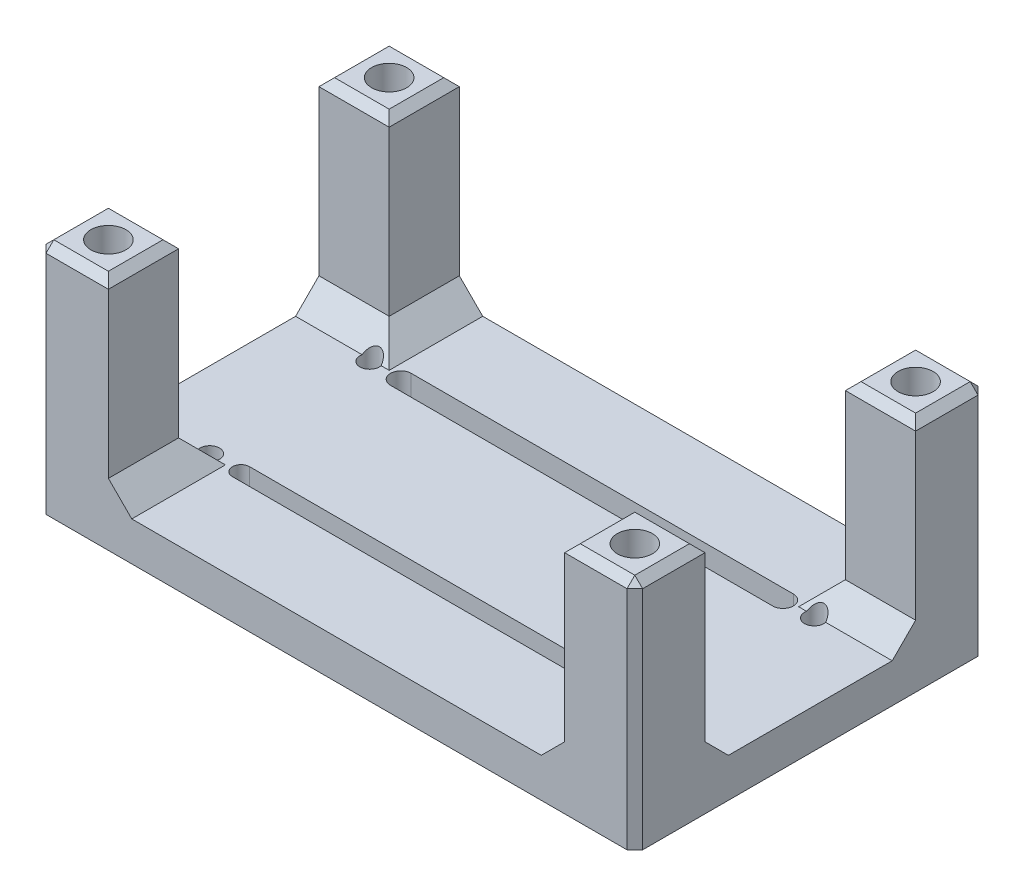
from build123d import *

# Parameters (mm, degrees)
SKETCH1_W           = 76.5
SKETCH1_H           = 45
SKETCH1_R           = 1.25
BOSS_EXTRUDE1_DEPTH = 5
SKETCH2_W           = 9
SKETCH2_H           = 9
SKETCH2_R           = 2.25
BOSS_EXTRUDE2_DEPTH = 25
CHAMFER1_SIZE       = 1
CHAMFER2_SIZE       = 3


with BuildPart() as part:
    # Sketch1 → Boss-Extrude1 (new body)
    with BuildSketch(Plane(origin=(0, 0, 0), x_dir=(1, 0, 0), z_dir=(0, 1, 0))):
        with Locations((38.25, 22.5)):
            Rectangle(SKETCH1_W, SKETCH1_H)
        with Locations(Location((9.75, 32.75, 0), (0, 0, 270))):
            Circle(SKETCH1_R, mode=Mode.SUBTRACT)
        with Locations(Location((9.75, 12.25, 0), (0, 0, 270))):
            Circle(SKETCH1_R, mode=Mode.SUBTRACT)
        with Locations(Location((66.75, 12.25, 0), (0, 0, 270))):
            Circle(SKETCH1_R, mode=Mode.SUBTRACT)
        with Locations(Location((66.75, 32.75, 0), (0, 0, 270))):
            Circle(SKETCH1_R, mode=Mode.SUBTRACT)
        with BuildLine():
            Line((13.75, 34.080542855), (62.75, 34.080542855))
            ThreePointArc((62.75, 34.080542855), (64.080542855, 32.75), (62.75, 31.419457145))
            Line((62.75, 31.419457145), (13.75, 31.419457145))
            ThreePointArc((13.75, 31.419457145), (12.419457145, 32.75), (13.75, 34.080542855))
        make_face(mode=Mode.SUBTRACT)
        with BuildLine():
            Line((13.75, 13.352251527), (62.75, 13.352251527))
            ThreePointArc((62.75, 13.352251527), (63.852251527, 12.25), (62.75, 11.147748473))
            Line((62.75, 11.147748473), (13.75, 11.147748473))
            ThreePointArc((13.75, 11.147748473), (12.647748473, 12.25), (13.75, 13.352251527))
        make_face(mode=Mode.SUBTRACT)
    extrude(amount=BOSS_EXTRUDE1_DEPTH)

    # Sketch2 → Boss-Extrude2 (add)
    # profile 1 of 4: a face of its own
    with BuildSketch(Plane(origin=(0, 5, 0), x_dir=(1, 0, 0), z_dir=(0, 1, 0))):
        with Locations((4.5, 40.5)):
            Rectangle(SKETCH2_W, SKETCH2_H)
        with Locations(Location((4.5, 40.5, 0), (0, 0, 270))):
            Circle(SKETCH2_R, mode=Mode.SUBTRACT)
    # profile 2 of 4: a face of its own
    with BuildSketch(Plane(origin=(0, 5, 0), x_dir=(1, 0, 0), z_dir=(0, 1, 0))):
        with Locations((4.5, 4.5)):
            Rectangle(SKETCH2_W, SKETCH2_H)
        with Locations(Location((4.5, 4.5, 0), (0, 0, 270))):
            Circle(SKETCH2_R, mode=Mode.SUBTRACT)
    # profile 3 of 4: a face of its own
    with BuildSketch(Plane(origin=(0, 5, 0), x_dir=(1, 0, 0), z_dir=(0, 1, 0))):
        with Locations((72, 4.5)):
            Rectangle(SKETCH2_W, SKETCH2_H)
        with Locations(Location((72, 4.5, 0), (0, 0, 270))):
            Circle(SKETCH2_R, mode=Mode.SUBTRACT)
    # profile 4 of 4: a face of its own
    with BuildSketch(Plane(origin=(0, 5, 0), x_dir=(1, 0, 0), z_dir=(0, 1, 0))):
        with Locations((72, 40.5)):
            Rectangle(SKETCH2_W, SKETCH2_H)
        with Locations(Location((72, 40.5, 0), (0, 0, 270))):
            Circle(SKETCH2_R, mode=Mode.SUBTRACT)
    extrude(amount=BOSS_EXTRUDE2_DEPTH)

    # Chamfer1
    chamfer1_edges = [part.edges().sort_by_distance(p)[0] for p in [
        (76.5, 30, -40.5),
        (72, 30, -45),
        (67.5, 30, -40.5),
        (72, 30, -36),
        (0, 30, -40.5),
        (4.5, 30, -36),
        (9, 30, -40.5),
        (4.5, 30, -45),
        (0, 30, -4.5),
        (4.5, 30, 0),
        (9, 30, -4.5),
        (4.5, 30, -9),
        (0, 15, -45),
        (76.5, 15, -45),
        (76.5, 15, 0),
        (0, 15, 0),
        (76.5, 30, -4.5),
        (72, 30, -9),
        (67.5, 30, -4.5),
        (72, 30, 0),
    ]]
    chamfer(chamfer1_edges, length=CHAMFER1_SIZE)

    # Chamfer2
    # the kernel refuses this chamfer: 3 mm, written as the material it adds along each edge
    with BuildSketch(Plane(origin=(67.5, 5, -45), x_dir=(-1, 0, 0), z_dir=(0, 0, 1))) as chamfer2_piece_1_section:
        Polygon((CHAMFER2_SIZE, 0), (0, -CHAMFER2_SIZE), (0, 0), align=None)
    chamfer2_piece_1 = extrude(amount=16.715048964, mode=Mode.PRIVATE)
    chamfer2_piece_1 = chamfer2_piece_1 - Plane(origin=(66.75, 5, -32.75), x_dir=(0, 0, 1), z_dir=(0, -1, 0)) * Cylinder(1.25, 46, mode=Mode.PRIVATE)
    chamfer2_piece_1 = split(chamfer2_piece_1, bisect_by=Plane(origin=(67.5, 11, -39), z_dir=(0, -0.7071067811865476, -0.7071067811865476)), keep=Keep.TOP, mode=Mode.PRIVATE)
    add(chamfer2_piece_1)
    with BuildSketch(Plane(origin=(59.784951036, 5, -36), x_dir=(0, 0, 1), z_dir=(1, 0, 0))) as chamfer2_piece_2_section:
        Polygon((CHAMFER2_SIZE, 0), (0, -CHAMFER2_SIZE), (0, 0), align=None)
    chamfer2_piece_2 = extrude(amount=16.715048964, mode=Mode.PRIVATE)
    chamfer2_piece_2 = chamfer2_piece_2 - Plane(origin=(66.75, 5, -32.75), x_dir=(0, 0, 1), z_dir=(0, -1, 0)) * Cylinder(1.25, 46, mode=Mode.PRIVATE)
    chamfer2_piece_2 = split(chamfer2_piece_2, bisect_by=Plane(origin=(62.142475518, 2.642475518, -36), z_dir=(0.7071067811865476, -0.7071067811865476, 1.1165101928417953e-15)), keep=Keep.TOP, mode=Mode.PRIVATE)
    add(chamfer2_piece_2)
    with BuildSketch(Plane(origin=(16.715048964, 5, -36), x_dir=(0, 0, 1), z_dir=(-1, 0, 0))) as chamfer2_piece_3_section:
        Polygon((CHAMFER2_SIZE, 0), (0, CHAMFER2_SIZE), (0, 0), align=None)
    chamfer2_piece_3 = extrude(amount=16.715048964, mode=Mode.PRIVATE)
    chamfer2_piece_3 = chamfer2_piece_3 - Plane(origin=(9.75, 5, -32.75), x_dir=(0, 0, 1), z_dir=(0, -1, 0)) * Cylinder(1.25, 46, mode=Mode.PRIVATE)
    chamfer2_piece_3 = split(chamfer2_piece_3, bisect_by=Plane(origin=(14.357524482, 2.642475518, -36), z_dir=(-0.7071067811865476, -0.7071067811865476, 0)), keep=Keep.TOP, mode=Mode.PRIVATE)
    add(chamfer2_piece_3)
    with BuildSketch(Plane(origin=(9, 5, -45), x_dir=(1, 0, 0), z_dir=(0, 0, 1))) as chamfer2_piece_4_section:
        Polygon((CHAMFER2_SIZE, 0), (0, CHAMFER2_SIZE), (0, 0), align=None)
    chamfer2_piece_4 = extrude(amount=16.715048964, mode=Mode.PRIVATE)
    chamfer2_piece_4 = chamfer2_piece_4 - Plane(origin=(9.75, 5, -32.75), x_dir=(0, 0, 1), z_dir=(0, -1, 0)) * Cylinder(1.25, 46, mode=Mode.PRIVATE)
    chamfer2_piece_4 = split(chamfer2_piece_4, bisect_by=Plane(origin=(9, 11, -39), z_dir=(0, -0.7071067811865476, -0.7071067811865476)), keep=Keep.TOP, mode=Mode.PRIVATE)
    add(chamfer2_piece_4)
    with BuildSketch(Plane(origin=(9, 5, 0), x_dir=(0, 1, 0), z_dir=(0, 0, -1))) as chamfer2_piece_5_section:
        Polygon((CHAMFER2_SIZE, 0), (0, CHAMFER2_SIZE), (0, 0), align=None)
    chamfer2_piece_5 = extrude(amount=16.715048964, mode=Mode.PRIVATE)
    chamfer2_piece_5 = chamfer2_piece_5 - Plane(origin=(9.75, 5, -12.25), x_dir=(0, 0, 1), z_dir=(0, -1, 0)) * Cylinder(1.25, 46, mode=Mode.PRIVATE)
    chamfer2_piece_5 = split(chamfer2_piece_5, bisect_by=Plane(origin=(9, 11, -6), z_dir=(0, -0.7071067811865476, 0.7071067811865476)), keep=Keep.TOP, mode=Mode.PRIVATE)
    add(chamfer2_piece_5)
    with BuildSketch(Plane(origin=(16.715048964, 5, -9), x_dir=(0, 0, -1), z_dir=(-1, 0, 0))) as chamfer2_piece_6_section:
        Polygon((CHAMFER2_SIZE, 0), (0, -CHAMFER2_SIZE), (0, 0), align=None)
    chamfer2_piece_6 = extrude(amount=16.715048964, mode=Mode.PRIVATE)
    chamfer2_piece_6 = chamfer2_piece_6 - Plane(origin=(9.75, 5, -12.25), x_dir=(0, 0, 1), z_dir=(0, -1, 0)) * Cylinder(1.25, 46, mode=Mode.PRIVATE)
    chamfer2_piece_6 = split(chamfer2_piece_6, bisect_by=Plane(origin=(14.357524482, 2.642475518, -9), z_dir=(-0.7071067811865474, -0.7071067811865478, 0)), keep=Keep.TOP, mode=Mode.PRIVATE)
    add(chamfer2_piece_6)
    with BuildSketch(Plane(origin=(59.784951036, 5, -9), x_dir=(0, 0, -1), z_dir=(1, 0, 0))) as chamfer2_piece_7_section:
        Polygon((CHAMFER2_SIZE, 0), (0, CHAMFER2_SIZE), (0, 0), align=None)
    chamfer2_piece_7 = extrude(amount=16.715048964, mode=Mode.PRIVATE)
    chamfer2_piece_7 = chamfer2_piece_7 - Plane(origin=(66.75, 5, -12.25), x_dir=(0, 0, 1), z_dir=(0, -1, 0)) * Cylinder(1.25, 46, mode=Mode.PRIVATE)
    chamfer2_piece_7 = split(chamfer2_piece_7, bisect_by=Plane(origin=(62.142475518, 2.642475518, -9), z_dir=(0.7071067811865476, -0.7071067811865476, 0)), keep=Keep.TOP, mode=Mode.PRIVATE)
    add(chamfer2_piece_7)
    with BuildSketch(Plane(origin=(67.5, 5, 0), x_dir=(-1, 0, 0), z_dir=(0, 0, -1))) as chamfer2_piece_8_section:
        Polygon((CHAMFER2_SIZE, 0), (0, CHAMFER2_SIZE), (0, 0), align=None)
    chamfer2_piece_8 = extrude(amount=16.715048964, mode=Mode.PRIVATE)
    chamfer2_piece_8 = chamfer2_piece_8 - Plane(origin=(66.75, 5, -12.25), x_dir=(0, 0, 1), z_dir=(0, -1, 0)) * Cylinder(1.25, 46, mode=Mode.PRIVATE)
    chamfer2_piece_8 = split(chamfer2_piece_8, bisect_by=Plane(origin=(67.5, 11, -6), z_dir=(0, -0.7071067811865476, 0.7071067811865476)), keep=Keep.TOP, mode=Mode.PRIVATE)
    add(chamfer2_piece_8)


solid = part.part
